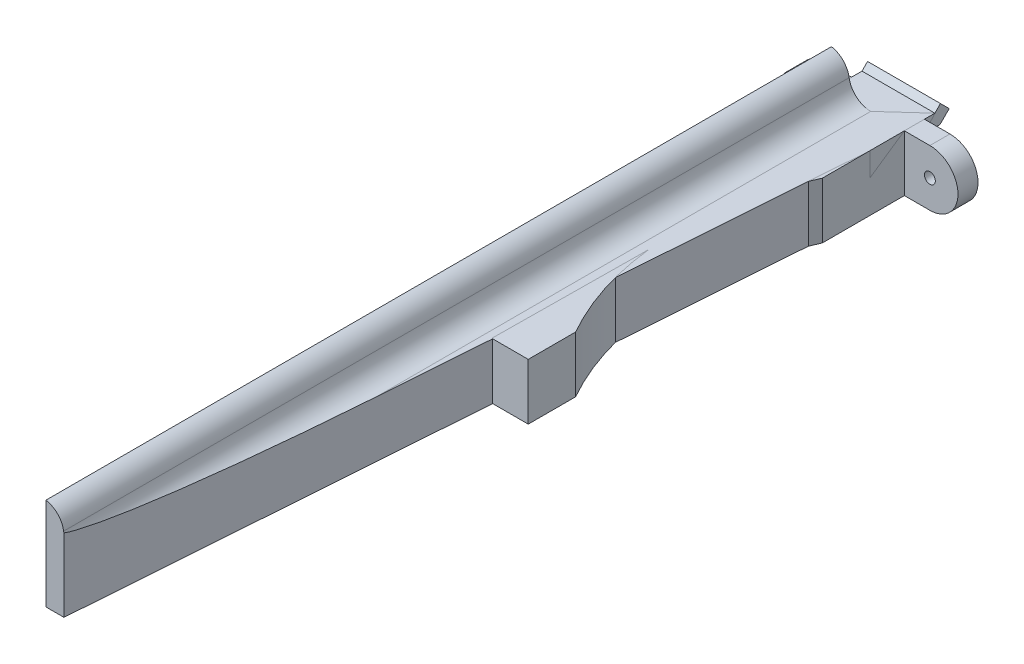
from build123d import *

# Parameters (mm, degrees)
SKETCH2_W           = 10
SKETCH2_H           = 14.768412439
BOSS_EXTRUDE1_DEPTH = 5
BOSS_EXTRUDE4_DEPTH = 10
SKETCH9_W           = 10
SKETCH9_H           = 3.18
SKETCH9_H_2         = 3.888412439
CUT_EXTRUDE3_DEPTH  = 5
BOSS_EXTRUDE5_DEPTH = 7.7
SKETCH12_R          = 0.75
BOSS_EXTRUDE7_DEPTH = 2.75
FILLET1_R           = 2.5
SKETCH13_W          = 13.67386451
SKETCH13_H          = 47.62797089
CUT_EXTRUDE4_DEPTH  = 100
SKETCH14_W          = 10
SKETCH14_H          = 7.7
BOSS_EXTRUDE8_DEPTH = 100
CUT_EXTRUDE5_DEPTH  = 100
SKETCH16_W          = 2.461316474
SKETCH16_H          = 107.75
BOSS_EXTRUDE9_DEPTH = 5
FILLET3_R           = 3
FILLET4_R           = 3


with BuildPart() as part:
    # Sketch2 → Boss-Extrude1 (new body)
    with BuildSketch(Plane.XY):
        with Locations((0, 1.566049366)):
            Rectangle(SKETCH2_W, SKETCH2_H)
    extrude(amount=BOSS_EXTRUDE1_DEPTH)

    # Sketch8 → Boss-Extrude4 (add)
    with BuildSketch(Plane.ZY.offset(5)):
        Polygon((-0.15, 5.770255585), (0, 5.770255585), (0, 4.070255585), (-0.15, 4.070255585), (-2.137867966, 4.070255585), (-3.402081528, 5.334469147), (-2.2, 6.536550675), (-1.43370491, 5.770255585), align=None)
        Polygon((-0.15, -1.929744415), (0, -1.929744415), (0, -0.229744415), (-0.15, -0.229744415), (-1.43370491, -0.229744415), (-2.2, 0.536550675), (-3.402081528, -0.665530853), (-2.137867966, -1.929744415), align=None)
    extrude(amount=-BOSS_EXTRUDE4_DEPTH)

    # Sketch9 → Cut-Extrude3 (cut)
    with BuildSketch(Plane(origin=(0, 0, 0), x_dir=(-1, 0, 0), z_dir=(0, 0, -1))):
        with Locations((0, 7.360255585)):
            Rectangle(SKETCH9_W, SKETCH9_H)
        with Locations((0, -3.873950635)):
            Rectangle(SKETCH9_W, SKETCH9_H_2)
    extrude(amount=-CUT_EXTRUDE3_DEPTH, mode=Mode.SUBTRACT)

    # Sketch10 → Boss-Extrude5 (add)
    with BuildSketch(Plane(origin=(0, 5.770255585, 0), x_dir=(1, 0, 0), z_dir=(0, 1, 0))):
        with BuildLine():
            Line((-5, -5), (-5, -10.5))
            Line((-5, -10.5), (1.352445729, -55.7))
            Line((1.352445729, -55.7), (6.352445729, -55.7))
            Line((6.352445729, -55.7), (6.352445729, -49.2))
            ThreePointArc((6.352445729, -49.2), (1.383429579, -31.764936646), (5, -14))
            Line((5, -14), (5, -5))
            Line((5, -5), (-5, -5))
        make_face()
    extrude(amount=-BOSS_EXTRUDE5_DEPTH)

    # Sketch12 → Boss-Extrude7 (add)
    with BuildSketch(Plane.XY):
        with BuildLine():
            Line((5, 5.770255585), (8.5, 5.770255585))
            ThreePointArc((8.5, 5.770255585), (12.35, 1.920255585), (8.5, -1.929744415))
            Line((8.5, -1.929744415), (5, -1.929744415))
            Line((5, -1.929744415), (5, 5.770255585))
        make_face()
        with Locations((8.5, 1.920255585)):
            Circle(SKETCH12_R, mode=Mode.SUBTRACT)
    extrude(amount=BOSS_EXTRUDE7_DEPTH)


with BuildPart() as body_2:
    # Mirror1: mirrored copy
    add(part.part.mirror(Plane(origin=(0, 0, 0), x_dir=(0, 0, 1), z_dir=(1, 0, 0))))

    # Fillet1
    fillet1_edges = [body_2.edges().sort_by_distance(p)[0] for p in [
        (-6.352445729, 1.920255585, 49.2),
        (-5, 1.920255585, 14),
        (-1.352445729, 1.920255585, 55.7),
        (-6.352445729, 1.920255585, 55.7),
    ]]
    fillet(fillet1_edges, radius=FILLET1_R)

    # Sketch13 → Cut-Extrude4 (cut)
    with BuildSketch(Plane(origin=(0, 5.770255585, 0), x_dir=(1, 0, 0), z_dir=(0, 1, 0))):
        with Locations((-1.836932255, -34.313985445)):
            Rectangle(SKETCH13_W, SKETCH13_H)
    extrude(amount=-CUT_EXTRUDE4_DEPTH, mode=Mode.SUBTRACT)

    # Sketch14 → Boss-Extrude8 (add)
    with BuildSketch(Plane.XY.offset(10.5)):
        with Locations((0, 1.920255585)):
            Rectangle(SKETCH14_W, SKETCH14_H)
    extrude(amount=BOSS_EXTRUDE8_DEPTH)

    # Sketch15 → Cut-Extrude5 (cut)
    with BuildSketch(Plane(origin=(0, 5.770255585, 0), x_dir=(1, 0, 0), z_dir=(0, 1, 0))):
        Polygon((5, -7.489382654), (-2.538683526, -110.5), (5, -110.5), align=None)
    extrude(amount=-CUT_EXTRUDE5_DEPTH, mode=Mode.SUBTRACT)

    # Sketch16 → Boss-Extrude9 (add)
    with BuildSketch(Plane(origin=(0, 5.770255585, 0), x_dir=(1, 0, 0), z_dir=(0, 1, 0))):
        with Locations((-3.769341763, -56.625)):
            Rectangle(SKETCH16_W, SKETCH16_H)
    extrude(amount=BOSS_EXTRUDE9_DEPTH)

    # Fillet3
    # the kernel refuses this fillet: 3 mm, written as the material it takes off along each edge
    with BuildSketch(Plane(origin=(-2.538683526, 10.770255585, -4.628101068), x_dir=(-1, 0, 0), z_dir=(0, 0, 1))) as fillet3_piece_1:
        with BuildLine():
            CenterArc((3, 2.951240427), FILLET3_R, 180, 79.655799439)
            Line((0, 2.951240427), (-0.06, 2.951240427))
            Line((-0.06, 2.951240427), (-0.06, 0))
            Line((-0.06, 0), (0, -0.06))
            ThreePointArc((0, -0.06), (1.230658237, -0.06), (2.450542803, -0.059024809))
            Line((2.450542803, -0.059024809), (2.461316474, 0))
        make_face()
    extrude(amount=122.506202136, mode=Mode.SUBTRACT)

    # Fillet4
    # the kernel refuses this fillet: 3 mm, written as the material it adds along each edge
    with BuildSketch(Plane(origin=(-2.538683526, 5.770255585, 2.75), x_dir=(1, 0, 0), z_dir=(0, 0, 1))) as fillet4_piece_1_section:
        with BuildLine():
            CenterArc((2.924115263, 3), FILLET4_R, 189.122166889, 80.877833111)
            Line((-0.037942368, 2.524379786), (-0.334148132, 2.476817765))
            ThreePointArc((-0.334148132, 2.476817765), (-0.3, 2.048759573), (-0.3, 0))
            Line((-0.3, 0), (0, -0.3))
            Line((0, -0.3), (2.924115263, -0.3))
            Line((2.924115263, -0.3), (2.924115263, 0))
        make_face()
    fillet4_piece_1 = extrude(amount=107.75, mode=Mode.PRIVATE)
    fillet4_piece_1 = split(fillet4_piece_1, bisect_by=Plane(origin=(1.704380037, 6.352962356, 52.521628105), z_dir=(-0.9973327924630033, 0, -0.07298836261999549)), keep=Keep.TOP, mode=Mode.PRIVATE)
    add(fillet4_piece_1)


solid = Compound([part.part, body_2.part])
